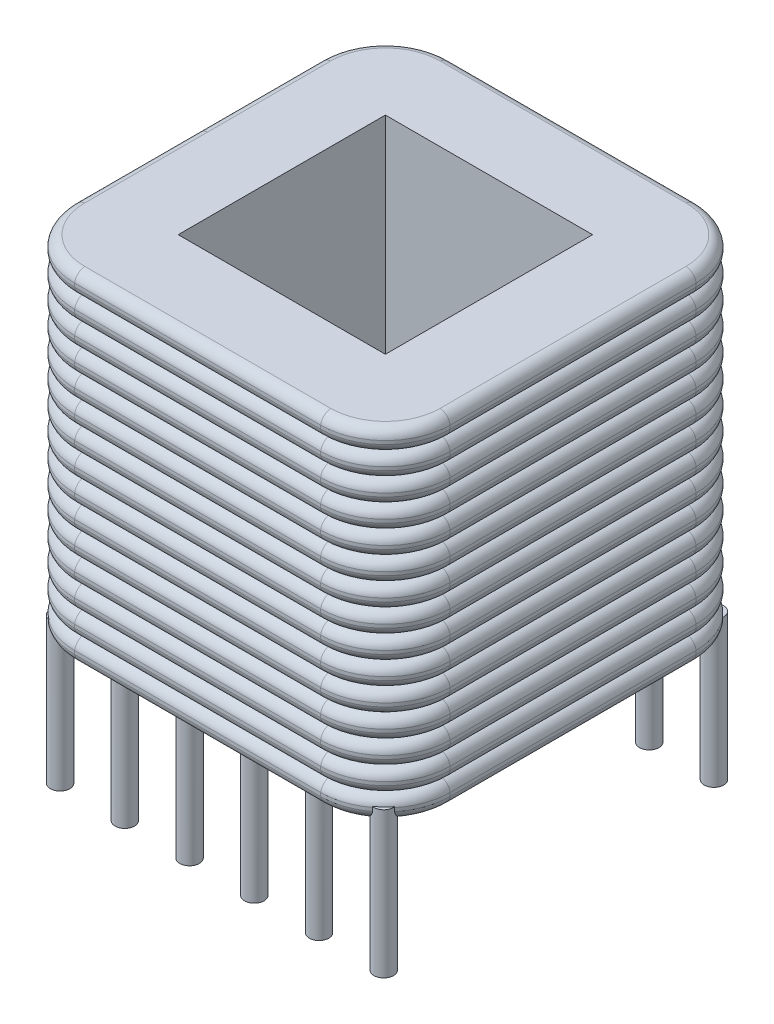
from build123d import *

# Parameters (mm, degrees)
SKETCH2_W                = 32
SKETCH2_H                = 32
BOSS_EXTRUDE1_DEPTH      = 26.5
BOSS_EXTRUDE2_DEPTH      = 20
BOSS_EXTRUDE2_DEPTH_BACK = 2.5
SKETCH5_R                = 1.5


with BuildPart() as part:
    # Sketch2 → Boss-Extrude1 (new, symmetric)
    with BuildSketch(Plane(origin=(0, 0, 0), x_dir=(1, 0, 0), z_dir=(0, 1, 0))):
        with BuildLine():
            Line((-29, 19), (-29, -19))
            ThreePointArc((-29, -19), (-26.071067812, -26.071067812), (-19, -29))
            Line((-19, -29), (19, -29))
            ThreePointArc((19, -29), (26.071067812, -26.071067812), (29, -19))
            Line((29, -19), (29, 19))
            ThreePointArc((29, 19), (26.071067812, 26.071067812), (19, 29))
            Line((19, 29), (-19, 29))
            ThreePointArc((-19, 29), (-26.071067812, 26.071067812), (-29, 19))
        make_face()
        Rectangle(SKETCH2_W, SKETCH2_H, mode=Mode.SUBTRACT)
    extrude(amount=BOSS_EXTRUDE1_DEPTH, both=True)

    # Cut-Sweep1: sweep along a path in Sketch4
    with BuildLine(Plane(origin=(0, 26.5, 0), x_dir=(1, 0, 0), z_dir=(0, 1, 0))) as cut_sweep1_path:
        Line((19, 29), (-19, 29))
        ThreePointArc((-19, 29), (-26.071067812, 26.071067812), (-29, 19))
        Line((-29, 19), (-29, -19))
        ThreePointArc((-29, -19), (-26.071067812, -26.071067812), (-19, -29))
        Line((-19, -29), (19, -29))
        ThreePointArc((19, -29), (26.071067812, -26.071067812), (29, -19))
        Line((29, -19), (29, 19))
        ThreePointArc((29, 19), (26.071067812, 26.071067812), (19, 29))
    # Sketch3 → Cut-Sweep1 (sweep, cut)
    with BuildSketch(Plane.XY):
        with BuildLine():
            Line((-27.271007608, 26.51), (-27.271007608, 27.710617915))
            Line((-27.271007608, 27.710617915), (-29.678781636, 27.710617915))
            Line((-29.678781636, 27.710617915), (-29.678781636, -28.059093804))
            Line((-29.678781636, -28.059093804), (-27.271007608, -28.059093804))
            Line((-27.271007608, -28.059093804), (-27.271007608, -26.13))
            ThreePointArc((-27.271007608, -26.13), (-29.021007608, -24.38), (-27.271007608, -22.63))
            Line((-27.271007608, -22.63), (-27.271007608, -22.62))
            ThreePointArc((-27.271007608, -22.62), (-29.021007608, -20.87), (-27.271007608, -19.12))
            Line((-27.271007608, -19.12), (-27.271007608, -19.11))
            ThreePointArc((-27.271007608, -19.11), (-29.021007608, -17.36), (-27.271007608, -15.61))
            Line((-27.271007608, -15.61), (-27.271007608, -15.6))
            ThreePointArc((-27.271007608, -15.6), (-29.021007608, -13.85), (-27.271007608, -12.1))
            Line((-27.271007608, -12.1), (-27.271007608, -12.09))
            ThreePointArc((-27.271007608, -12.09), (-29.021007608, -10.34), (-27.271007608, -8.59))
            Line((-27.271007608, -8.59), (-27.271007608, -8.58))
            ThreePointArc((-27.271007608, -8.58), (-29.021007608, -6.83), (-27.271007608, -5.08))
            Line((-27.271007608, -5.08), (-27.271007608, -5.07))
            ThreePointArc((-27.271007608, -5.07), (-29.021007608, -3.32), (-27.271007608, -1.57))
            Line((-27.271007608, -1.57), (-27.271007608, -1.56))
            ThreePointArc((-27.271007608, -1.56), (-29.021007608, 0.19), (-27.271007608, 1.94))
            Line((-27.271007608, 1.94), (-27.271007608, 1.95))
            ThreePointArc((-27.271007608, 1.95), (-29.021007608, 3.7), (-27.271007608, 5.45))
            Line((-27.271007608, 5.45), (-27.271007608, 5.46))
            ThreePointArc((-27.271007608, 5.46), (-29.021007608, 7.21), (-27.271007608, 8.96))
            Line((-27.271007608, 8.96), (-27.271007608, 8.97))
            ThreePointArc((-27.271007608, 8.97), (-29.021007608, 10.72), (-27.271007608, 12.47))
            Line((-27.271007608, 12.47), (-27.271007608, 12.48))
            ThreePointArc((-27.271007608, 12.48), (-29.021007608, 14.23), (-27.271007608, 15.98))
            Line((-27.271007608, 15.98), (-27.271007608, 15.99))
            ThreePointArc((-27.271007608, 15.99), (-29.021007608, 17.74), (-27.271007608, 19.49))
            Line((-27.271007608, 19.49), (-27.271007608, 19.5))
            ThreePointArc((-27.271007608, 19.5), (-29.021007608, 21.25), (-27.271007608, 23))
            Line((-27.271007608, 23), (-27.271007608, 23.01))
            ThreePointArc((-27.271007608, 23.01), (-29.021007608, 24.76), (-27.271007608, 26.51))
        make_face()
    sweep(path=cut_sweep1_path.line, mode=Mode.SUBTRACT)

    # Sketch5 → Boss-Extrude2 (add, two sides: drawn at the far end of the back side and taken through both)
    with BuildSketch(Plane.XZ.offset(26.5).offset(-BOSS_EXTRUDE2_DEPTH_BACK)):
        with Locations((-24.75, 25.5)):
            Circle(SKETCH5_R)
        with Locations((-14.75, 25.5)):
            Circle(SKETCH5_R)
        with Locations((-4.75, 25.5)):
            Circle(SKETCH5_R)
        with Locations((5.25, 25.5)):
            Circle(SKETCH5_R)
        with Locations((15.25, 25.5)):
            Circle(SKETCH5_R)
        with Locations((25.25, 25.5)):
            Circle(SKETCH5_R)
        with Locations((-14.75, -25.5)):
            Circle(SKETCH5_R)
        with Locations((-4.75, -25.5)):
            Circle(SKETCH5_R)
        with Locations((5.25, -25.5)):
            Circle(SKETCH5_R)
        with Locations((15.25, -25.5)):
            Circle(SKETCH5_R)
        with Locations((25.25, -25.5)):
            Circle(SKETCH5_R)
        with Locations((-24.75, -25.5)):
            Circle(SKETCH5_R)
    extrude(amount=BOSS_EXTRUDE2_DEPTH + BOSS_EXTRUDE2_DEPTH_BACK)


solid = part.part
